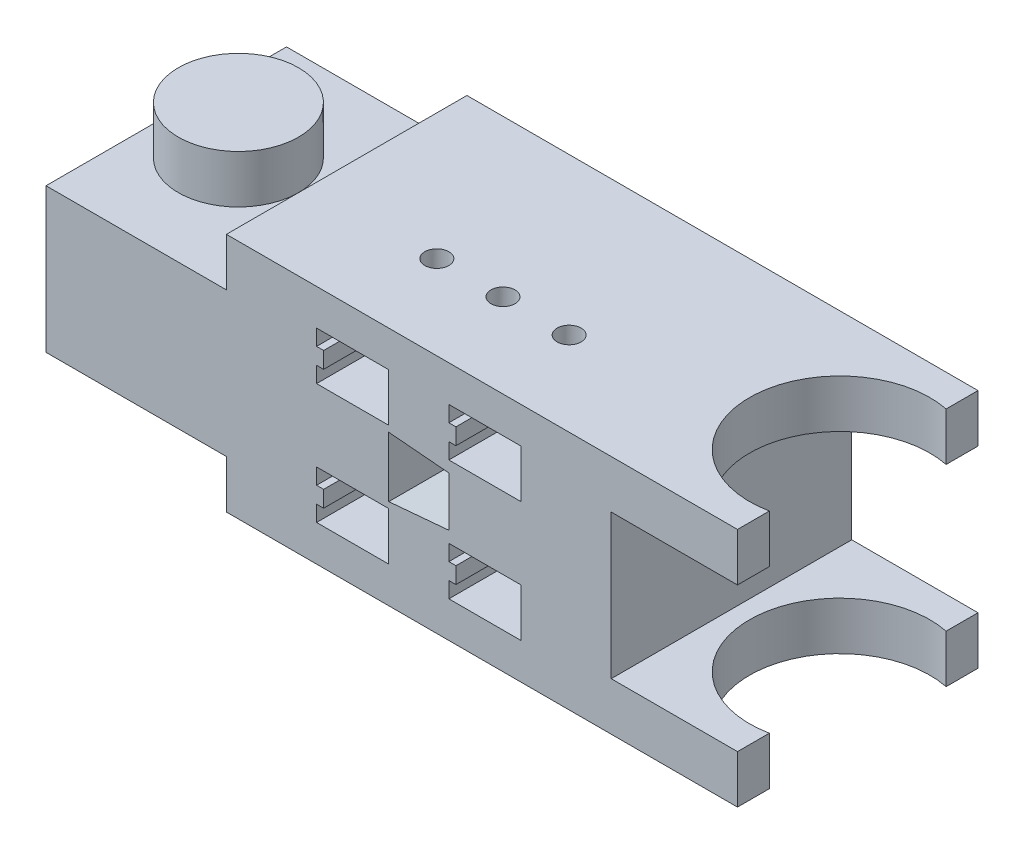
from build123d import *

# Parameters (mm, degrees)
BOSS_EXTRUDE1_DEPTH = 20
SKETCH2_R           = 5
BOSS_EXTRUDE2_DEPTH = 4
CUT_EXTRUDE1_REACH  = 64.738
SKETCH3_R           = 7.5
CUT_EXTRUDE2_DEPTH  = 10
SKETCH5_W           = 6
SKETCH5_H           = 4
CUT_EXTRUDE3_DEPTH  = 10
CUT_EXTRUDE4_REACH  = 64.738
SKETCH6_R           = 1
CHAMFER1_SIZE       = 3
SKETCH7_W           = 1.173916184
SKETCH7_H           = 1.359310186
BOSS_EXTRUDE3_DEPTH = 10


with BuildPart() as part:
    # Sketch1 → Boss-Extrude1 (new body)
    with BuildSketch(Plane.XY):
        Polygon((-41, -10), (-41, -6), (-50, -6), (-56, -6), (-56, 6), (-50, 6), (-41, 6), (-41, 10), (0, 10), (1.5, 10), (1.5, 6), (0, 6), (-9, 6), (-9, -6), (0, -6), (1.5, -6), (1.5, -10), (0, -10), align=None)
    extrude(amount=BOSS_EXTRUDE1_DEPTH)

    # Sketch2 → Boss-Extrude2 (add)
    with BuildSketch(Plane.XZ.offset(6)):
        with Locations(Location((-50, 10, 0), (0, 0, 180))):
            Circle(SKETCH2_R)
    boss_extrude2 = extrude(amount=BOSS_EXTRUDE2_DEPTH)

    # Cut-Extrude1: up to this face of the body (flat: up to its plane)
    cut_extrude1_end = Plane(part.part.faces().sort_by_distance((-19.75, 10, 10))[0])
    # Sketch3 → Cut-Extrude1 (cut, up to the picked face)
    with BuildSketch(Plane.XZ.offset(10), mode=Mode.PRIVATE) as cut_extrude1_sk1:
        with Locations((0, 10)):
            Circle(SKETCH3_R)
    cut_extrude1_tool1 = split(extrude(cut_extrude1_sk1.sketch, amount=-CUT_EXTRUDE1_REACH, mode=Mode.PRIVATE), bisect_by=cut_extrude1_end, keep=Keep.BOTH, mode=Mode.PRIVATE)
    add(cut_extrude1_tool1.solids().sort_by(Axis((0, -10, 10), (0, 1, 0)))[0], mode=Mode.SUBTRACT)

    # Mirror1: Boss-Extrude2 across plane
    add(boss_extrude2.mirror(Plane.ZX))

    # Sketch4 → Cut-Extrude2 (cut)
    with BuildSketch(Plane.XY.offset(20)):
        Polygon((-27.5, 2.5), (-22.5, 2.062556682), (-22.5, -2.062556682), (-27.5, -2.5), align=None)
    extrude(amount=-CUT_EXTRUDE2_DEPTH, mode=Mode.SUBTRACT)

    # Sketch5 → Cut-Extrude3 (cut)
    with BuildSketch(Plane.XY.offset(20)):
        with Locations((-30.5, 5)):
            Rectangle(SKETCH5_W, SKETCH5_H)
        with Locations((-19.5, 5)):
            Rectangle(SKETCH5_W, SKETCH5_H)
        with Locations((-19.5, -5)):
            Rectangle(SKETCH5_W, SKETCH5_H)
        with Locations((-30.5, -5)):
            Rectangle(SKETCH5_W, SKETCH5_H)
    extrude(amount=-CUT_EXTRUDE3_DEPTH, mode=Mode.SUBTRACT)

    # Cut-Extrude4: up to this face of the body (flat: up to its plane)
    cut_extrude4_end = Plane(part.part.faces().sort_by_distance((-22.349651974, 10, 10))[0])
    # Sketch6 → Cut-Extrude4 (cut, up to the picked face)
    with BuildSketch(Plane.XZ.offset(10), mode=Mode.PRIVATE) as cut_extrude4_sk1:
        with Locations((-30.5, 13)):
            Circle(SKETCH6_R)
    cut_extrude4_tool1 = split(extrude(cut_extrude4_sk1.sketch, amount=-CUT_EXTRUDE4_REACH, mode=Mode.PRIVATE), bisect_by=cut_extrude4_end, keep=Keep.BOTH, mode=Mode.PRIVATE)
    # Sketch6 → Cut-Extrude4 (cut, up to the picked face)
    with BuildSketch(Plane.XZ.offset(10), mode=Mode.PRIVATE) as cut_extrude4_sk2:
        with Locations((-25, 13)):
            Circle(SKETCH6_R)
    cut_extrude4_tool2 = split(extrude(cut_extrude4_sk2.sketch, amount=-CUT_EXTRUDE4_REACH, mode=Mode.PRIVATE), bisect_by=cut_extrude4_end, keep=Keep.BOTH, mode=Mode.PRIVATE)
    # Sketch6 → Cut-Extrude4 (cut, up to the picked face)
    with BuildSketch(Plane.XZ.offset(10), mode=Mode.PRIVATE) as cut_extrude4_sk3:
        with Locations(Location((-19.5, 13, 0), (0, 0, 270))):
            Circle(SKETCH6_R)
    cut_extrude4_tool3 = split(extrude(cut_extrude4_sk3.sketch, amount=-CUT_EXTRUDE4_REACH, mode=Mode.PRIVATE), bisect_by=cut_extrude4_end, keep=Keep.BOTH, mode=Mode.PRIVATE)
    add(cut_extrude4_tool1.solids().sort_by(Axis((-30.5, -10, 13), (0, 1, 0)))[0], mode=Mode.SUBTRACT)
    add(cut_extrude4_tool2.solids().sort_by(Axis((-25, -10, 13), (0, 1, 0)))[0], mode=Mode.SUBTRACT)
    add(cut_extrude4_tool3.solids().sort_by(Axis((-19.5, -10, 13), (0, 1, 0)))[0], mode=Mode.SUBTRACT)

    # Chamfer1
    # the kernel refuses this chamfer: 3 mm, written as the material it takes off along each edge
    with BuildSketch(Plane(origin=(-30.5, -10, 13), x_dir=(1, 0, 0), z_dir=(0, 0, -1))) as chamfer1_piece_1:
        Polygon((1 + CHAMFER1_SIZE, 0), (1, -CHAMFER1_SIZE), (1, 0), align=None)
    revolve(axis=Axis((-30.5, -10, 13), (0, -1, 0)), mode=Mode.SUBTRACT)
    with BuildSketch(Plane(origin=(-25, -10, 13), x_dir=(1, 0, 0), z_dir=(0, 0, -1))) as chamfer1_piece_2:
        Polygon((1 + CHAMFER1_SIZE, 0), (1, -CHAMFER1_SIZE), (1, 0), align=None)
    revolve(axis=Axis((-25, -10, 13), (0, -1, 0)), mode=Mode.SUBTRACT)
    with BuildSketch(Plane(origin=(-19.5, -10, 13), x_dir=(0, 0, -1), z_dir=(-1, 0, 0))) as chamfer1_piece_3:
        Polygon((1 + CHAMFER1_SIZE, 0), (1, -CHAMFER1_SIZE), (1, 0), align=None)
    revolve(axis=Axis((-19.5, -10, 13), (0, -1, 0)), mode=Mode.SUBTRACT)

    # Sketch7 → Boss-Extrude3 (add)
    with BuildSketch(Plane.XY.offset(20)):
        with Locations((-22.5, -5)):
            Rectangle(SKETCH7_W, SKETCH7_H)
        with Locations((-33.5, -5)):
            Rectangle(SKETCH7_W, SKETCH7_H)
        with Locations((-33.5, 5)):
            Rectangle(SKETCH7_W, SKETCH7_H)
        with Locations((-22.5, 5)):
            Rectangle(SKETCH7_W, SKETCH7_H)
    extrude(amount=-BOSS_EXTRUDE3_DEPTH)


solid = part.part
